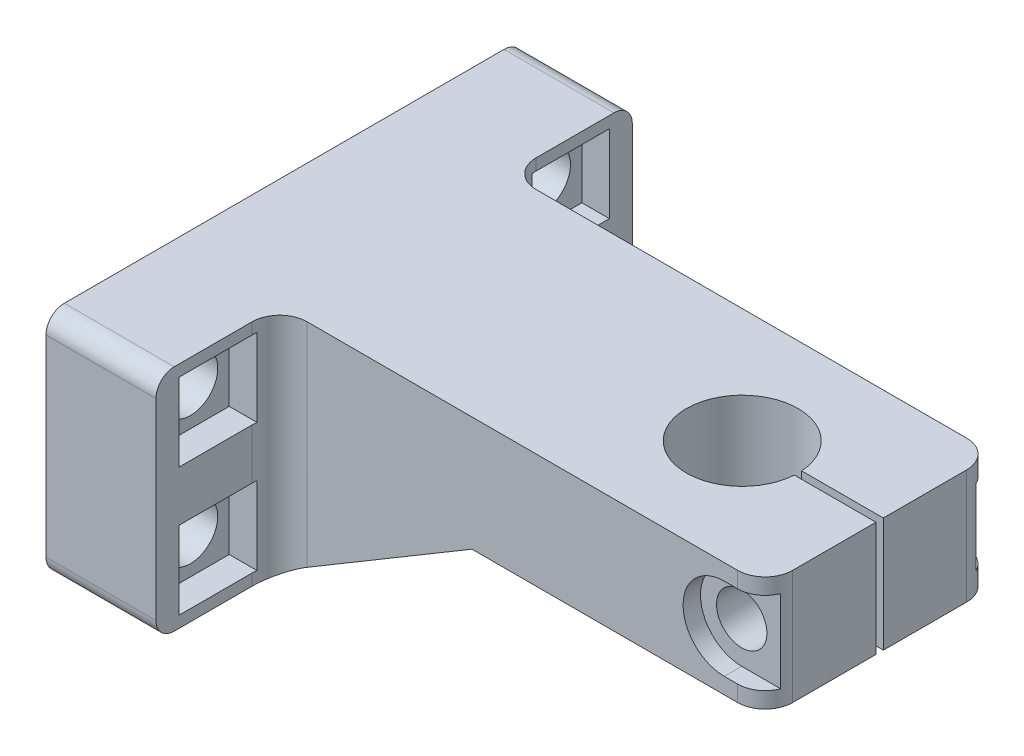
from build123d import *

# Parameters (mm, degrees)
BOSS_EXTRUDE1_DEPTH     = 12.5
SKETCH2_W               = 52
SKETCH2_H               = 25
SKETCH2_R               = 3
BOSS_EXTRUDE2_DEPTH     = 12
CUT_EXTRUDE2_DEPTH      = 75.33707016
FILLET1_R               = 2
FILLET2_R               = 3
CUT_EXTRUDE3_DEPTH      = 75.47791619
CUT_EXTRUDE3_DEPTH_BACK = 75.47791619
SKETCH7_R               = 2.75
CUT_EXTRUDE4_START      = 11
SKETCH7_3_R             = 2.75
CUT_EXTRUDE4_DEPTH      = 20
SKETCH9_W               = 8.25
SKETCH9_H               = 8.25
CUT_EXTRUDE5_DEPTH      = 3
SKETCH12_W              = 8.5
SKETCH12_H              = 8.5
CUT_EXTRUDE7_DEPTH      = 3
FILLET3_R               = 3


with BuildPart() as part:
    # Sketch1 → Boss-Extrude1 (new, symmetric)
    with BuildSketch(Plane.XY):
        Polygon((12, -25), (33, -12.5), (65, -12.5), (65, 0), (0, 0), (0, -25), align=None)
    extrude(amount=BOSS_EXTRUDE1_DEPTH, both=True)

    # Sketch2 → Boss-Extrude2 (add)
    with BuildSketch(Plane.ZY):
        with Locations((0, -12.5)):
            Rectangle(SKETCH2_W, SKETCH2_H)
        with Locations(Location((-19.25, -5.5, 0), (0, 0, 270))):
            Circle(SKETCH2_R, mode=Mode.SUBTRACT)
        with Locations(Location((-19.25, -19.5, 0), (0, 0, 270))):
            Circle(SKETCH2_R, mode=Mode.SUBTRACT)
        with Locations(Location((19.25, -19.5, 0), (0, 0, 270))):
            Circle(SKETCH2_R, mode=Mode.SUBTRACT)
        with Locations(Location((19.25, -5.5, 0), (0, 0, 270))):
            Circle(SKETCH2_R, mode=Mode.SUBTRACT)
    extrude(amount=-BOSS_EXTRUDE2_DEPTH)

    # Sketch4 → Cut-Extrude2 (cut, through all)
    with BuildSketch(Plane(origin=(0, 0, 0), x_dir=(1, 0, 0), z_dir=(0, 1, 0))):
        with BuildLine():
            Line((56.086871117, -0.4), (65, -0.4))
            Line((65, -0.4), (65, 0.4))
            Line((65, 0.4), (56.086871117, 0.4))
            ThreePointArc((56.086871117, 0.4), (43.9, 0), (56.086871117, -0.4))
        make_face()
    extrude(amount=-CUT_EXTRUDE2_DEPTH, mode=Mode.SUBTRACT)

    # Fillet1
    fillet1_edges = [part.edges().sort_by_distance(p)[0] for p in [
        (6, -25, -26),
        (6, 0, -26),
        (6, 0, 26),
        (6, -25, 26),
    ]]
    fillet(fillet1_edges, radius=FILLET1_R)

    # Fillet2
    fillet2_edges = [part.edges().sort_by_distance(p)[0] for p in [
        (65, -6.25, 12.5),
        (65, -6.25, -12.5),
    ]]
    fillet(fillet2_edges, radius=FILLET2_R)

    # Sketch7 → Cut-Extrude3 (cut, two sides: drawn at the far end of the back side and taken through both)
    with BuildSketch(Plane.XY.offset(-0.4).offset(-CUT_EXTRUDE3_DEPTH_BACK)):
        with Locations(Location((60.543435559, -6.25, 0), (0, 0, 58.017528447))):
            Circle(SKETCH7_R)
    extrude(amount=CUT_EXTRUDE3_DEPTH + CUT_EXTRUDE3_DEPTH_BACK, mode=Mode.SUBTRACT)

    # Sketch7<3> → Cut-Extrude4 (cut)
    with BuildSketch(Plane.XY.offset(-0.4).offset(CUT_EXTRUDE4_START)):
        with Locations((60.543435559, -6.25)):
            Circle(SKETCH7_3_R)
        with BuildLine():
            Line((60.543435559, -1.75), (65, -1.75))
            Line((65, -1.75), (65, -10.75))
            Line((65, -10.75), (60.543435559, -10.75))
            ThreePointArc((60.543435559, -10.75), (56.043435559, -6.25), (60.543435559, -1.75))
        make_face()
    extrude(amount=CUT_EXTRUDE4_DEPTH, mode=Mode.SUBTRACT)

    # Sketch9 → Cut-Extrude5 (cut)
    with BuildSketch(Plane(origin=(0, 0, -12.5), x_dir=(-1, 0, 0), z_dir=(0, 0, -1))):
        with Locations((-60.543435559, -6.25)):
            Rectangle(SKETCH9_W, SKETCH9_H)
    extrude(amount=-CUT_EXTRUDE5_DEPTH, mode=Mode.SUBTRACT)

    # Sketch12 → Cut-Extrude7 (cut)
    with BuildSketch(Plane(origin=(12, 0, 0), x_dir=(0, 0, -1), z_dir=(1, 0, 0))):
        with Locations((19.25, -5.5)):
            Rectangle(SKETCH12_W, SKETCH12_H)
        with Locations((-19.25, -5.5)):
            Rectangle(SKETCH12_W, SKETCH12_H)
        with Locations((19.25, -19.5)):
            Rectangle(SKETCH12_W, SKETCH12_H)
        with Locations((-19.25, -19.5)):
            Rectangle(SKETCH12_W, SKETCH12_H)
    extrude(amount=-CUT_EXTRUDE7_DEPTH, mode=Mode.SUBTRACT)

    # Fillet3
    # the kernel refuses this fillet: 3 mm, written as the material it adds along each edge
    with BuildSketch(Plane(origin=(12, -32.5, -12.5), x_dir=(1, 0, 0), z_dir=(0, 1, 0))) as fillet3_piece_1_section:
        with BuildLine():
            CenterArc((FILLET3_R, FILLET3_R), FILLET3_R, 180, 90)
            Line((0, FILLET3_R), (0, 0))
            Line((0, 0), (FILLET3_R, 0))
        make_face()
    fillet3_piece_1 = extrude(amount=32.5, mode=Mode.PRIVATE)
    fillet3_piece_1 = split(fillet3_piece_1, bisect_by=Plane(origin=(12.672630608, -24.599624638, -13.288072161), z_dir=(-0.5114838597676827, 0.8592928844097069, 0)), keep=Keep.TOP, mode=Mode.PRIVATE)
    fillet3_piece_1 = split(fillet3_piece_1, bisect_by=Plane(origin=(12.457820622, -24.238743862, -15), z_dir=(0, 0, 1)), keep=Keep.TOP, mode=Mode.PRIVATE)
    add(fillet3_piece_1)
    with BuildSketch(Plane(origin=(12, -32.5, -12.5), x_dir=(1, 0, 0), z_dir=(0, 1, 0))) as fillet3_piece_2_section:
        with BuildLine():
            CenterArc((FILLET3_R, FILLET3_R), FILLET3_R, 180, 90)
            Line((0, FILLET3_R), (0, 0))
            Line((0, 0), (FILLET3_R, 0))
        make_face()
    fillet3_piece_2 = extrude(amount=40, mode=Mode.PRIVATE)
    fillet3_piece_2 = split(fillet3_piece_2, bisect_by=Plane(origin=(12.285585988, -24.830008341, -15.125075667), z_dir=(-0.5114838597676827, 0.8592928844097069, 0)), keep=Keep.TOP, mode=Mode.PRIVATE)
    fillet3_piece_2 = split(fillet3_piece_2, bisect_by=Plane(origin=(12.012528257, -23.75, -15.125075667), z_dir=(0, -1, 0)), keep=Keep.TOP, mode=Mode.PRIVATE)
    add(fillet3_piece_2)
    with BuildSketch(Plane(origin=(12, -32.5, -12.5), x_dir=(1, 0, 0), z_dir=(0, 1, 0))) as fillet3_piece_3_section:
        with BuildLine():
            CenterArc((FILLET3_R, FILLET3_R), FILLET3_R, 180, 90)
            Line((0, FILLET3_R), (0, 0))
            Line((0, 0), (FILLET3_R, 0))
        make_face()
    fillet3_piece_3 = extrude(amount=40, mode=Mode.PRIVATE)
    fillet3_piece_3 = split(fillet3_piece_3, bisect_by=Plane(origin=(12.012572796, -15.25, -15.124824501), z_dir=(0, 1, 0)), keep=Keep.TOP, mode=Mode.PRIVATE)
    fillet3_piece_3 = split(fillet3_piece_3, bisect_by=Plane(origin=(12.012572796, -9.75, -15.124824501), z_dir=(0, -1, 0)), keep=Keep.TOP, mode=Mode.PRIVATE)
    add(fillet3_piece_3)
    with BuildSketch(Plane(origin=(12, -32.5, -12.5), x_dir=(1, 0, 0), z_dir=(0, 1, 0))) as fillet3_piece_4_section:
        with BuildLine():
            CenterArc((FILLET3_R, FILLET3_R), FILLET3_R, 180, 90)
            Line((0, FILLET3_R), (0, 0))
            Line((0, 0), (FILLET3_R, 0))
        make_face()
    fillet3_piece_4 = extrude(amount=32.5, mode=Mode.PRIVATE)
    fillet3_piece_4 = split(fillet3_piece_4, bisect_by=Plane(origin=(12.012572796, -1.25, -15.124824501), z_dir=(0, 1, 0)), keep=Keep.TOP, mode=Mode.PRIVATE)
    add(fillet3_piece_4)
    with BuildSketch(Plane(origin=(12, -32.5, 12.5), x_dir=(1, 0, 0), z_dir=(0, 1, 0))) as fillet3_piece_5_section:
        with BuildLine():
            CenterArc((FILLET3_R, -FILLET3_R), FILLET3_R, 90, 90)
            Line((0, -FILLET3_R), (0, 0))
            Line((0, 0), (FILLET3_R, 0))
        make_face()
    fillet3_piece_5 = extrude(amount=32.5, mode=Mode.PRIVATE)
    fillet3_piece_5 = split(fillet3_piece_5, bisect_by=Plane(origin=(12.672630608, -24.599624638, 13.288072161), z_dir=(-0.5114838597676827, 0.8592928844097069, 0)), keep=Keep.TOP, mode=Mode.PRIVATE)
    fillet3_piece_5 = split(fillet3_piece_5, bisect_by=Plane(origin=(12.457820622, -24.238743862, 15), z_dir=(0, 0, -1)), keep=Keep.TOP, mode=Mode.PRIVATE)
    add(fillet3_piece_5)
    with BuildSketch(Plane(origin=(12, -32.5, 12.5), x_dir=(1, 0, 0), z_dir=(0, 1, 0))) as fillet3_piece_6_section:
        with BuildLine():
            CenterArc((FILLET3_R, -FILLET3_R), FILLET3_R, 90, 90)
            Line((0, -FILLET3_R), (0, 0))
            Line((0, 0), (FILLET3_R, 0))
        make_face()
    fillet3_piece_6 = extrude(amount=40, mode=Mode.PRIVATE)
    fillet3_piece_6 = split(fillet3_piece_6, bisect_by=Plane(origin=(12.285585988, -24.830008341, 15.125075667), z_dir=(-0.5114838597676827, 0.8592928844097069, 0)), keep=Keep.TOP, mode=Mode.PRIVATE)
    fillet3_piece_6 = split(fillet3_piece_6, bisect_by=Plane(origin=(12.012528257, -23.75, 15.125075667), z_dir=(0, -1, 0)), keep=Keep.TOP, mode=Mode.PRIVATE)
    add(fillet3_piece_6)
    with BuildSketch(Plane(origin=(12, -32.5, 12.5), x_dir=(1, 0, 0), z_dir=(0, 1, 0))) as fillet3_piece_7_section:
        with BuildLine():
            CenterArc((FILLET3_R, -FILLET3_R), FILLET3_R, 90, 90)
            Line((0, -FILLET3_R), (0, 0))
            Line((0, 0), (FILLET3_R, 0))
        make_face()
    fillet3_piece_7 = extrude(amount=40, mode=Mode.PRIVATE)
    fillet3_piece_7 = split(fillet3_piece_7, bisect_by=Plane(origin=(12.012572796, -15.25, 15.124824501), z_dir=(0, 1, 0)), keep=Keep.TOP, mode=Mode.PRIVATE)
    fillet3_piece_7 = split(fillet3_piece_7, bisect_by=Plane(origin=(12.012572796, -9.75, 15.124824501), z_dir=(0, -1, 0)), keep=Keep.TOP, mode=Mode.PRIVATE)
    add(fillet3_piece_7)
    with BuildSketch(Plane(origin=(12, -32.5, 12.5), x_dir=(1, 0, 0), z_dir=(0, 1, 0))) as fillet3_piece_8_section:
        with BuildLine():
            CenterArc((FILLET3_R, -FILLET3_R), FILLET3_R, 90, 90)
            Line((0, -FILLET3_R), (0, 0))
            Line((0, 0), (FILLET3_R, 0))
        make_face()
    fillet3_piece_8 = extrude(amount=32.5, mode=Mode.PRIVATE)
    fillet3_piece_8 = split(fillet3_piece_8, bisect_by=Plane(origin=(12.012572796, -1.25, 15.124824501), z_dir=(0, 1, 0)), keep=Keep.TOP, mode=Mode.PRIVATE)
    add(fillet3_piece_8)


solid = part.part
